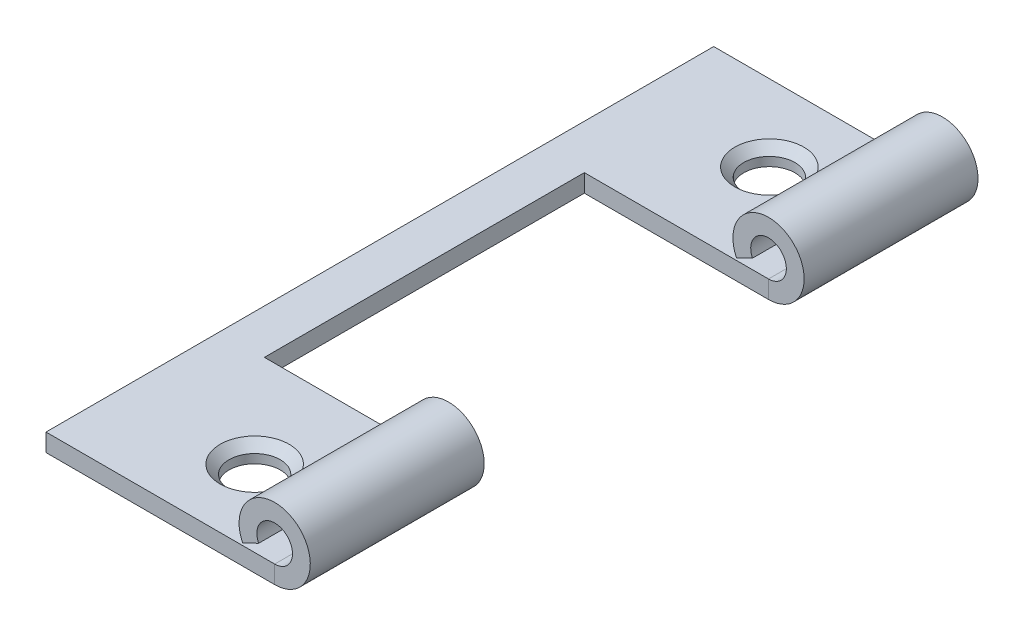
from build123d import *

# Parameters (mm, degrees)
BASE_FLANGE1_DEPTH = 2.032
SKETCH6_R          = 2.921
CUT_EXTRUDE1_DEPTH = 2.54
HEM1_START         = -38.1
HEM1_DEPTH         = 76.2
HEM1_2_DEPTH       = 19.84375
HEM1_START_2       = 18.25625
HEM1_3_DEPTH       = 19.84375
CHAMFER2_SIZE      = 1.016


# Read off the part's stored shape, not the designer's step: Hem1
# Sheet-metal steps are written as plain solids
with BuildPart() as part:
    # Sketch1 → Base-Flange1 (new body)
    with BuildSketch(Plane(origin=(0, 0, 0), x_dir=(1, 0, 0), z_dir=(0, 1, 0))):
        Polygon((-15.08125, 38.1), (15.08125, 38.1), (15.08125, 18.25625), (-10.00125, 18.25625), (-10.00125, -18.25625), (15.08125, -18.25625), (15.08125, -38.1), (-15.08125, -38.1), align=None)
    extrude(amount=BASE_FLANGE1_DEPTH)

    # Sketch6 → Cut-Extrude1 (cut)
    with BuildSketch(Plane(origin=(0, 2.032, 0), x_dir=(1, 0, 0), z_dir=(0, 1, 0))):
        with Locations(Location((0, 29.36875, 0), (0, 0, 270))):
            Circle(SKETCH6_R)
        with Locations(Location((0, -29.36875, 0), (0, 0, 270))):
            Circle(SKETCH6_R)
    extrude(amount=-CUT_EXTRUDE1_DEPTH, mode=Mode.SUBTRACT)

    # Hem1 outline → Hem1 (cut)
    with BuildSketch(Plane.XY.offset(HEM1_START)):
        with BuildLine():
            Line((15.08125, 2.032), (14.536777241, 2.032))
            ThreePointArc((14.536777241, 2.032), (13.04925, 0.544472759), (11.01725, 0))
            Line((11.01725, 0), (15.08125, 0))
            Line((15.08125, 0), (15.08125, 2.032))
        make_face()
    extrude(amount=HEM1_DEPTH, mode=Mode.SUBTRACT)

    # Hem1 2 outline → Hem1 2 (add)
    with BuildSketch(Plane.XY.offset(HEM1_START)):
        with BuildLine():
            Line((7.364550996, 2.282459659), (9.190900498, 3.17322983))
            ThreePointArc((9.190900498, 3.17322983), (12.094045945, 5.787233731), (11.01725, 2.032))
            Line((11.01725, 2.032), (14.536777241, 2.032))
            ThreePointArc((14.536777241, 2.032), (11.159081554, 8.125524321), (7.364550996, 2.282459659))
        make_face()
    extrude(amount=HEM1_2_DEPTH)

    # Hem1 3 outline → Hem1 3 (add)
    with BuildSketch(Plane.XY.offset(HEM1_START_2)):
        with BuildLine():
            Line((7.364550996, 2.282459659), (9.190900498, 3.17322983))
            ThreePointArc((9.190900498, 3.17322983), (12.094045945, 5.787233731), (11.01725, 2.032))
            Line((11.01725, 2.032), (14.536777241, 2.032))
            ThreePointArc((14.536777241, 2.032), (11.159081554, 8.125524321), (7.364550996, 2.282459659))
        make_face()
    extrude(amount=HEM1_3_DEPTH)

    # Chamfer2
    chamfer2_edges = [part.edges().sort_by_distance(p)[0] for p in [
        (0, 2.032, -32.28975),
        (0, 2.032, 26.44775),
    ]]
    chamfer(chamfer2_edges, length=CHAMFER2_SIZE)


solid = part.part
